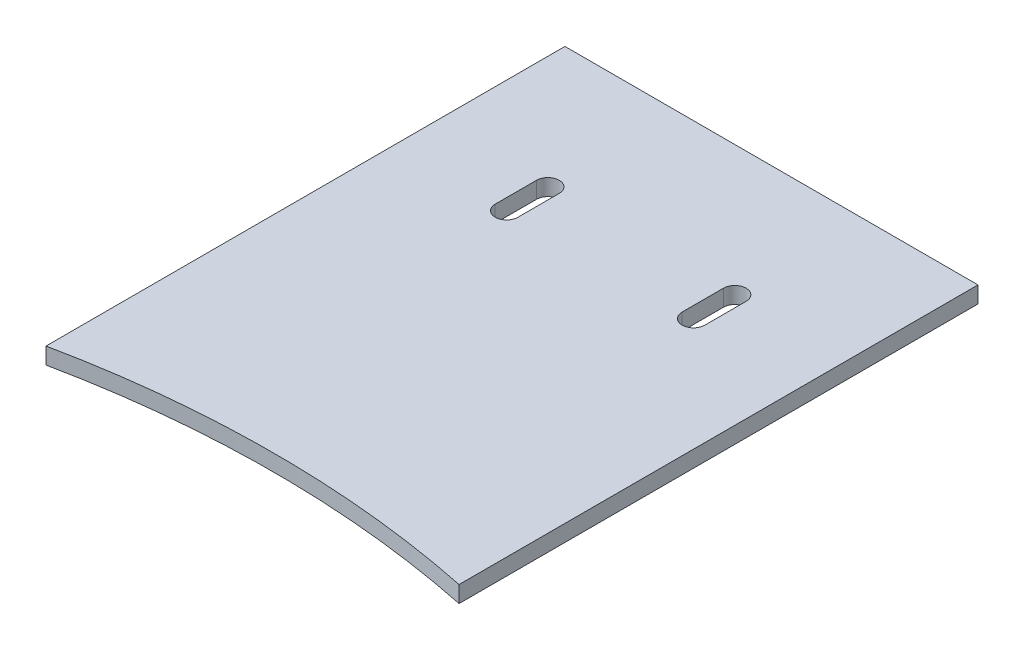
from build123d import *

# Parameters (mm, degrees)
SM_BASE_FLANGE_1_DEPTH = 16


# Sheet-metal steps are written as plain solids
with BuildPart() as part:
    # Sketch 1 → 基体-法兰1 (new body)
    with BuildSketch(Plane(origin=(0, 0, 0), x_dir=(1, 0, 0), z_dir=(0, 1, 0))):
        with BuildLine():
            Line((-200, 964.992357483), (-200, 1467.5))
            Line((-200, 1467.5), (200, 1467.5))
            Line((200, 1467.5), (200, 964.992357483))
            ThreePointArc((200, 964.992357483), (0, 985.5), (-200, 964.992357483))
        make_face()
        with BuildLine():
            Line((-79.5, 1341.5), (-79.5, 1301.5))
            ThreePointArc((-79.5, 1301.5), (-90.5, 1290.5), (-101.5, 1301.5))
            Line((-101.5, 1301.5), (-101.5, 1341.5))
            ThreePointArc((-101.5, 1341.5), (-90.5, 1352.5), (-79.5, 1341.5))
        make_face(mode=Mode.SUBTRACT)
        with BuildLine():
            Line((79.5, 1301.5), (79.5, 1341.5))
            ThreePointArc((79.5, 1341.5), (90.5, 1352.5), (101.5, 1341.5))
            Line((101.5, 1341.5), (101.5, 1301.5))
            ThreePointArc((101.5, 1301.5), (90.5, 1290.5), (79.5, 1301.5))
        make_face(mode=Mode.SUBTRACT)
    extrude(amount=SM_BASE_FLANGE_1_DEPTH)


solid = part.part
